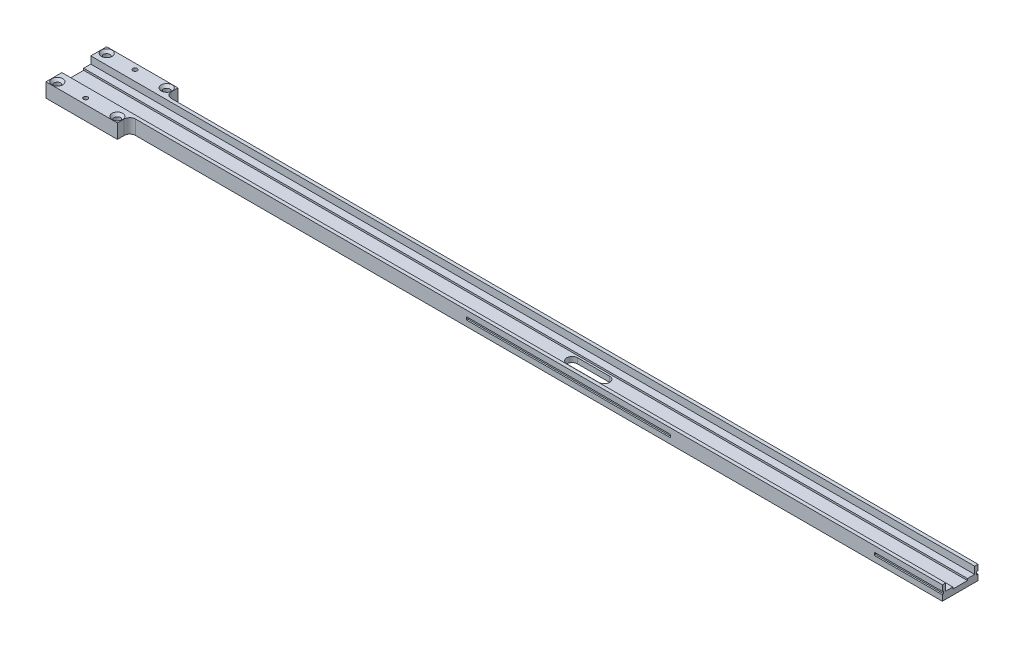
from build123d import *

# Parameters (mm, degrees)
SKETCH1_W                                      = 247.65
SKETCH1_H                                      = 10
BOSS_EXTRUDE1_DEPTH                            = 4
CUT_EXTRUDE1_DEPTH                             = 248.732764284
CUT_EXTRUDE2_DEPTH                             = 1.5
CUT_EXTRUDE3_START                             = -114.3
SKETCH13_W                                     = 0.79375
SKETCH13_H                                     = 0.79375
CUT_EXTRUDE3_DEPTH                             = 57.15
LPATTERN1_COUNT                                = 2
LPATTERN1_PITCH                                = 114.3
SKETCH14_W                                     = 20
SKETCH14_H                                     = 4
BOSS_EXTRUDE3_DEPTH                            = 3.5
F_0_80_TAPPED_HOLE2_D                          = 1.19126
CSK_FOR_0_FLAT_HEAD_MACHINE_SCREW1_D           = 1.778
CSK_FOR_0_FLAT_HEAD_MACHINE_SCREW1_CSINK_D     = 3.0226
CSK_FOR_0_FLAT_HEAD_MACHINE_SCREW1_CSINK_ANGLE = 82
MIRROR3_START                                  = -114.3
MIRROR3_COPY_1_SKETCH_W                        = 0.79375
MIRROR3_COPY_1_SKETCH_H                        = 0.79375
MIRROR3_COPY_1_DEPTH                           = 57.15
FILLET6_R                                      = 1.5875


# Read off the part's stored shape, not the designer's step: Cut-Extrude2
with BuildPart() as part:
    # Sketch1 → Boss-Extrude1 (new body)
    with BuildSketch(Plane(origin=(0, 0, 0), x_dir=(1, 0, 0), z_dir=(0, 1, 0))):
        Rectangle(SKETCH1_W, SKETCH1_H)
    extrude(amount=BOSS_EXTRUDE1_DEPTH)

    # Sketch2 → Cut-Extrude1 (cut, through all)
    with BuildSketch(Plane.ZY.offset(123.825)):
        Polygon((-2.05, 1.5), (2.05, 1.5), (2.05, 2), (4.05, 2), (4.05, 4), (-4.05, 4), (-4.05, 2), (-2.05, 2), align=None)
    extrude(amount=-CUT_EXTRUDE1_DEPTH, mode=Mode.SUBTRACT)

    # Cut-Extrude2 outline → Cut-Extrude2 (cut)
    with BuildSketch(Plane(origin=(0, 0, 0), x_dir=(1, 0, 0), z_dir=(0, 1, 0))):
        with BuildLine():
            Line((24.1088, 1.5), (15.1088, 1.5))
            ThreePointArc((15.1088, 1.5), (13.6088, 0), (15.1088, -1.5))
            Line((15.1088, -1.5), (24.1088, -1.5))
            ThreePointArc((24.1088, -1.5), (25.6088, 0), (24.1088, 1.5))
        make_face()
    extrude(amount=CUT_EXTRUDE2_DEPTH, mode=Mode.SUBTRACT)

    # Sketch13 → Cut-Extrude3 (cut)
    with BuildSketch(Plane.ZY.offset(123.825).offset(CUT_EXTRUDE3_START)):
        with Locations((-5, 2)):
            Rectangle(SKETCH13_W, SKETCH13_H)
    cut_extrude3 = extrude(amount=-CUT_EXTRUDE3_DEPTH, mode=Mode.SUBTRACT)

    # LPattern1: Cut-Extrude3 ×2
    with Locations(*[(i * LPATTERN1_PITCH, 0, 0) for i in range(1, LPATTERN1_COUNT)]):
        add(cut_extrude3, mode=Mode.SUBTRACT)

    # Sketch14 → Boss-Extrude3 (add)
    with BuildSketch(Plane(origin=(0, 0, -5), x_dir=(-1, 0, 0), z_dir=(0, 0, -1))):
        with Locations((113.825, 2)):
            Rectangle(SKETCH14_W, SKETCH14_H)
    boss_extrude3 = extrude(amount=BOSS_EXTRUDE3_DEPTH)

    # #0-80 Tapped Hole2 (through all)
    with Locations(Plane(origin=(0, 4, 0), x_dir=(-1, 0, 0), z_dir=(0, 1, 0))):
        with Locations((114.3, -6.9125)):
            f_0_80_tapped_hole2 = Hole(F_0_80_TAPPED_HOLE2_D / 2)

    # CSK for #0 Flat Head Machine Screw1 (through all)
    with Locations(Plane(origin=(0, 4, 0), x_dir=(-1, 0, 0), z_dir=(0, 1, 0))):
        with Locations((105.4125, -6.9125), (122.2375, -6.9125)):
            csk_for_0_flat_head_machine_screw1 = CounterSinkHole(CSK_FOR_0_FLAT_HEAD_MACHINE_SCREW1_D / 2, CSK_FOR_0_FLAT_HEAD_MACHINE_SCREW1_CSINK_D / 2, counter_sink_angle=CSK_FOR_0_FLAT_HEAD_MACHINE_SCREW1_CSINK_ANGLE)

    # Mirror3: Cut-Extrude3, Boss-Extrude3, #0-80 Tapped Hole2, CSK for #0 Flat Head Machine Screw1 across plane
    add(cut_extrude3.mirror(Plane.XY), mode=Mode.SUBTRACT)
    add(boss_extrude3.mirror(Plane.XY))
    add(f_0_80_tapped_hole2.mirror(Plane.XY), mode=Mode.SUBTRACT)
    add(csk_for_0_flat_head_machine_screw1.mirror(Plane.XY), mode=Mode.SUBTRACT)

    # Mirror3 copy 1 sketch → Mirror3 copy 1 (cut)
    with BuildSketch(Plane(origin=(-9.525, 0, 0), x_dir=(0, 0, -1), z_dir=(-1, 0, 0)).offset(MIRROR3_START)):
        with Locations((-5, -2)):
            Rectangle(MIRROR3_COPY_1_SKETCH_W, MIRROR3_COPY_1_SKETCH_H)
    extrude(amount=-MIRROR3_COPY_1_DEPTH, mode=Mode.SUBTRACT)

    # Fillet6
    fillet6_edges = [part.edges().sort_by_distance(p)[0] for p in [
        (-103.825, 2, -5),
        (-103.825, 2, 5),
    ]]
    fillet(fillet6_edges, radius=FILLET6_R)


solid = part.part
